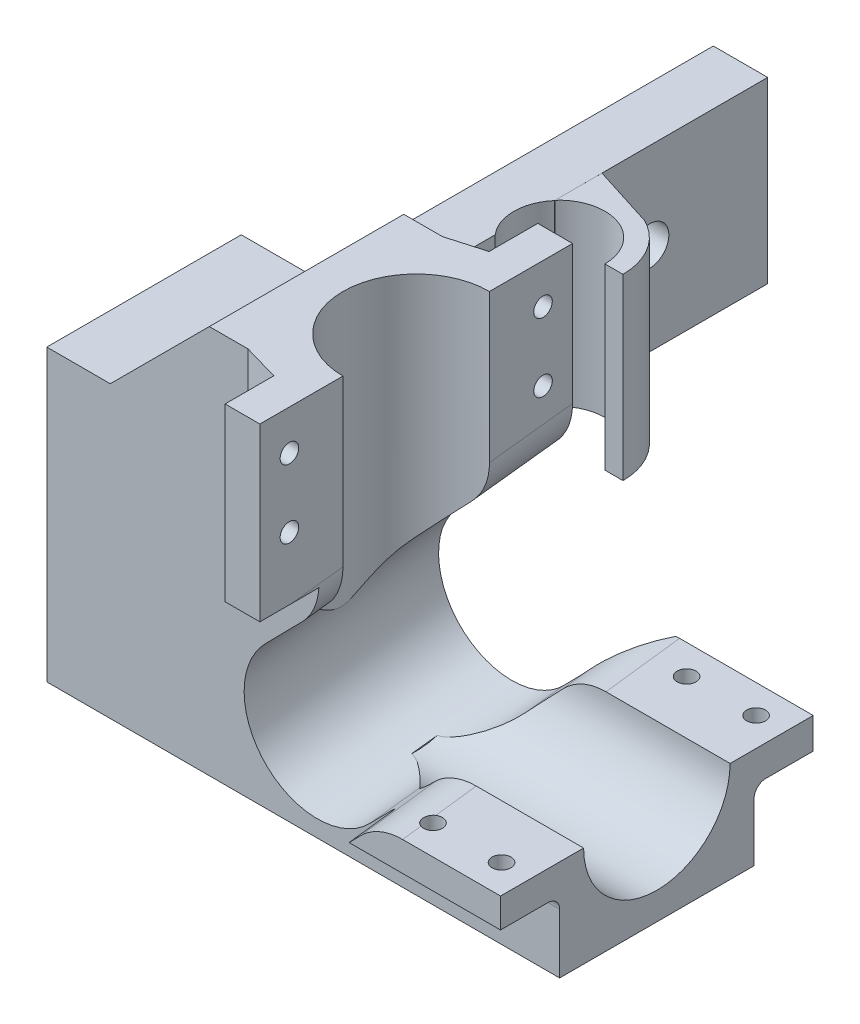
from build123d import *
from OCP.BRepFilletAPI import BRepFilletAPI_MakeChamfer
from build123d.topology import SkipClean

# Parameters (mm, degrees)
BOSS_EXTRUDE1_START      = -152.4
SKETCH2_W                = 105.618637884
SKETCH2_H                = 145.103309092
BOSS_EXTRUDE1_DEPTH      = 139.7
CUT_EXTRUDE2_DEPTH       = 885.237993682
CUT_EXTRUDE2_DEPTH_BACK  = 51.562
SKETCH5_R                = 12.827
CUT_EXTRUDE3_DEPTH       = 445.860765858
CUT_EXTRUDE3_DEPTH_BACK  = 42.164
SKETCH6_R                = 12.827
CUT_EXTRUDE4_DEPTH       = 445.860765858
CUT_EXTRUDE4_DEPTH_BACK  = 445.860765858
CUT_EXTRUDE5_DEPTH       = 50.504651
CUT_EXTRUDE6_DEPTH       = 407.363854058
CUT_EXTRUDE6_DEPTH_BACK  = 407.363854058
SKETCH9_R                = 3.3782
CUT_EXTRUDE7_DEPTH       = 877.507710408
CUT_EXTRUDE7_DEPTH_BACK  = 877.507710408
SKETCH10_W               = 42.138106051
SKETCH10_H               = 18.044478892
SKETCH14_W               = 10.350939284
SKETCH14_H               = 12.032329604
CUT_EXTRUDE9_DEPTH       = 389.423133713
SKETCH15_R               = 7.9375
CUT_EXTRUDE10_DEPTH      = 855.097071361
BOSS_EXTRUDE3_DEPTH      = 31.28
CUT_EXTRUDE11_REACH      = 385.336
SKETCH17_W               = 10.350939284
SKETCH17_H               = 5.407782796
CUT_EXTRUDE12_REACH      = 385.336
SKETCH18_W               = 82.65793149
SKETCH18_H               = 30.038621058
SKETCH20_R               = 1.625
CUT_EXTRUDE13_DEPTH      = 6.088729488
SKETCH21_R               = 1.65
CUT_EXTRUDE14_DEPTH      = 854.709330565
FILLET1_R                = 2.032
FILLET2_R                = 12.7
CUT_EXTRUDE15_DEPTH      = 825.577740132
CUT_EXTRUDE15_DEPTH_BACK = 825.577740132
FILLET3_R                = 10.16
CUT_EXTRUDE16_DEPTH      = 855.611797525
CUT_EXTRUDE16_DEPTH_BACK = 17.338621
SKETCH23_W               = 28.46620038
SKETCH23_H               = 34.049959426
CHAMFER1_SIZE            = 17.3482
CHAMFER2_START           = -213.720216756
CHAMFER2_DEPTH           = 31.28
CHAMFER2_2_DEPTH         = 31.28
CHAMFER3_SIZE            = 5.969
CHAMFER3_SIZE2           = 10.33861127
CHAMFER4_SIZE            = 6.35
CHAMFER4_SIZE2           = 1.8208332


with BuildPart() as part:
    # Sketch2 → Boss-Extrude1 (new body)
    with BuildSketch(Plane(origin=(0, 0, 0), x_dir=(1, 0, 0), z_dir=(0, 1, 0)).offset(BOSS_EXTRUDE1_START)):
        with Locations((-760.171212891, -245.918743343)):
            Rectangle(SKETCH2_W, SKETCH2_H)
    extrude(amount=-BOSS_EXTRUDE1_DEPTH)

    # Sketch5 → Cut-Extrude2 (cut, two sides: drawn at the far end of the back side and taken through both)
    with BuildSketch(Plane(origin=(0, -152.4, 0), x_dir=(1, 0, 0), z_dir=(0, 1, 0)).offset(-CUT_EXTRUDE2_DEPTH_BACK)):
        with Locations(Location((-749.5, -273.05, 0), (0, 0, 90))):
            Circle(SKETCH5_R)
    extrude(amount=CUT_EXTRUDE2_DEPTH + CUT_EXTRUDE2_DEPTH_BACK, mode=Mode.SUBTRACT)

    # Sketch6 → Cut-Extrude3 (cut, two sides: drawn at the far end of the back side and taken through both)
    with SkipClean():  # the faces are left unmerged after this step: merging them gives an invalid solid
        with BuildSketch(Plane(origin=(-707.361893949, 0, 0), x_dir=(0, 0, -1), z_dir=(1, 0, 0)).offset(-CUT_EXTRUDE3_DEPTH_BACK)):
            with Locations((-273.05, -202.904651163)):
                Circle(SKETCH6_R)
        extrude(amount=CUT_EXTRUDE3_DEPTH + CUT_EXTRUDE3_DEPTH_BACK, mode=Mode.SUBTRACT)

    # Sketch7 → Cut-Extrude4 (cut, two sides: drawn at the far end of the back side and taken through both)
    with SkipClean():  # the faces are left unmerged after this step: merging them gives an invalid solid
        with BuildSketch(Plane.ZY.offset(812.980531833).offset(-CUT_EXTRUDE4_DEPTH_BACK)):
            Polygon((173.367088797, -229.244173065), (318.470397889, -229.244173065), (436.616381599, -1092.879705033), (85.103632852, -1063.090489038), align=None)
        extrude(amount=CUT_EXTRUDE4_DEPTH + CUT_EXTRUDE4_DEPTH_BACK, mode=Mode.SUBTRACT)

    # Sketch8 → Cut-Extrude5 (cut)
    with BuildSketch(Plane.XZ.offset(152.4)):
        Polygon((-749.5, 285.877), (-749.5, 318.470397889), (-702.312681678, 322.788236882), (-679.04046523, 133.358726973), (-749.5, 173.367088797), (-749.5, 260.223), align=None)
    extrude(amount=CUT_EXTRUDE5_DEPTH, mode=Mode.SUBTRACT)

    # Sketch9 → Cut-Extrude6 (cut, two sides: drawn at the far end of the back side and taken through both)
    with BuildSketch(Plane.ZY.offset(812.980531833).offset(-CUT_EXTRUDE6_DEPTH_BACK)):
        with Locations((237.744, -197.6755)):
            Circle(SKETCH9_R)
        with Locations((194.056, -197.6755)):
            Circle(SKETCH9_R)
    extrude(amount=CUT_EXTRUDE6_DEPTH + CUT_EXTRUDE6_DEPTH_BACK, mode=Mode.SUBTRACT)

    # Sketch10 → Cut-Extrude7 (cut, two sides: drawn at the far end of the back side and taken through both)
    with BuildSketch(Plane(origin=(0, -152.4, 0), x_dir=(1, 0, 0), z_dir=(0, 1, 0)).offset(-CUT_EXTRUDE7_DEPTH_BACK)):
        Polygon((-797.161154045, -290.074979713), (-797.161154045, -173.367088797), (-812.980531833, -173.367088797), (-812.980531833, -318.470397889), (-778.610494828, -318.470397889), (-749.5, -318.470397889), (-749.5, -300.425918997), (-755.588729488, -300.425918997), (-755.588729488, -290.074979713), align=None)
        with BuildLine():
            Line((-704.994967799, -245.674081003), (-704.994967799, -173.367088797))
            Line((-704.994967799, -173.367088797), (-749.5, -173.367088797))
            Line((-749.5, -173.367088797), (-749.5, -245.674081003))
            Line((-749.5, -245.674081003), (-749.5, -254.969))
            ThreePointArc((-749.5, -254.969), (-746.410185862, -255.23496114), (-743.411270512, -256.025020287))
            Line((-743.411270512, -256.025020287), (-731.419, -256.025020287))
            Line((-731.419, -256.025020287), (-731.419, -245.674081003))
            Line((-731.419, -245.674081003), (-704.994967799, -245.674081003))
        make_face()
        Polygon((-749.5, -245.674081003), (-749.5, -173.367088797), (-787.636154045, -173.367088797), (-787.636154045, -256.025020287), (-755.588729488, -256.025020287), (-755.588729488, -245.674081003), align=None)
        with Locations((-728.430946975, -309.448158443)):
            Rectangle(SKETCH10_W, SKETCH10_H)
    extrude(amount=CUT_EXTRUDE7_DEPTH + CUT_EXTRUDE7_DEPTH_BACK, mode=Mode.SUBTRACT)

    # Sketch14 → Cut-Extrude9 (cut, through all)
    with BuildSketch(Plane.ZY.offset(797.161154045)):
        Polygon((173.367088797, -229.244173065), (173.367088797, -213.720216756), (256.025020287, -213.720216756), (256.025020287, -220.515241206), (290.074979713, -220.515241206), (290.074979713, -208.059525422), (300.425918997, -208.059525422), (300.425918997, -229.244173065), (290.074979713, -229.244173065), (256.025020287, -229.244173065), align=None)
        with Locations((295.250449355, -188.416164802)):
            Rectangle(SKETCH14_W, SKETCH14_H)
    extrude(amount=-CUT_EXTRUDE9_DEPTH, mode=Mode.SUBTRACT)

    # Sketch15 → Cut-Extrude10 (cut, through all)
    with BuildSketch(Plane.XZ.offset(213.720216756)):
        with Locations((-781.622028853, 215.9)):
            Circle(SKETCH15_R)
    extrude(amount=-CUT_EXTRUDE10_DEPTH, mode=Mode.SUBTRACT)

    # Sketch16 → Boss-Extrude3 (add)
    with BuildSketch(Plane.XZ.offset(213.720216756)):
        with BuildLine():
            Line((-789.623028853, 215.9), (-792.798028853, 215.9))
            ThreePointArc((-792.798028853, 215.9), (-781.622028853, 204.724), (-770.446028853, 215.9))
            Line((-770.446028853, 215.9), (-773.621028853, 215.9))
            ThreePointArc((-773.621028853, 215.9), (-781.622028853, 207.899), (-789.623028853, 215.9))
        make_face()
    extrude(amount=-BOSS_EXTRUDE3_DEPTH)

    # Cut-Extrude11: up to this face of the body (flat: up to its plane)
    cut_extrude11_end = Plane(part.part.faces().sort_by_distance((-787.636154045, -182.811410497, 238.56635645))[0])
    # Sketch17 → Cut-Extrude11 (cut, up to the picked face)
    with BuildSketch(Plane(origin=(-707.361893949, 0, 0), x_dir=(0, 0, -1), z_dir=(1, 0, 0)), mode=Mode.PRIVATE) as cut_extrude11_sk1:
        with Locations((-250.849550645, -211.016325358)):
            Rectangle(SKETCH17_W, SKETCH17_H)
    cut_extrude11_tool1 = split(extrude(cut_extrude11_sk1.sketch, amount=-CUT_EXTRUDE11_REACH, mode=Mode.PRIVATE), bisect_by=cut_extrude11_end, keep=Keep.BOTH, mode=Mode.PRIVATE)
    add(cut_extrude11_tool1.solids().sort_by(Axis((-707.361894, -211.016325, 250.849551), (-1, 0, 0)))[0], mode=Mode.SUBTRACT)

    # Cut-Extrude12: up to this face of the body (flat: up to its plane)
    cut_extrude12_end = Plane(part.part.faces().sort_by_distance((-787.636154045, -181.897567062, 191.002801609))[0])
    # Sketch18 → Cut-Extrude12 (cut, up to the picked face)
    with BuildSketch(Plane.ZY.offset(797.161154045), mode=Mode.PRIVATE) as cut_extrude12_sk1:
        with Locations((214.696054542, -167.419310529)):
            Rectangle(SKETCH18_W, SKETCH18_H)
    cut_extrude12_tool1 = split(extrude(cut_extrude12_sk1.sketch, amount=-CUT_EXTRUDE12_REACH, mode=Mode.PRIVATE), bisect_by=cut_extrude12_end, keep=Keep.BOTH, mode=Mode.PRIVATE)
    add(cut_extrude12_tool1.solids().sort_by(Axis((-797.161154, -167.419311, 214.696055), (1, 0, 0)))[0], mode=Mode.SUBTRACT)

    # Sketch20 → Cut-Extrude13 (cut)
    with BuildSketch(Plane.ZY.offset(749.5)):
        with Locations((295.250449355, -159.4)):
            Circle(SKETCH20_R)
        with Locations((295.250449355, -171.4)):
            Circle(SKETCH20_R)
        with Locations((250.849550645, -159.4)):
            Circle(SKETCH20_R)
        with Locations((250.849550645, -171.4)):
            Circle(SKETCH20_R)
    extrude(amount=CUT_EXTRUDE13_DEPTH, mode=Mode.SUBTRACT)

    # Sketch21 → Cut-Extrude14 (cut, through all)
    with BuildSketch(Plane.XZ.offset(208.059525422)):
        with Locations(Location((-724.361893949, 295.250449355, 0), (0, 0, 270))):
            Circle(SKETCH21_R)
        with Locations(Location((-712.361893949, 295.250449355, 0), (0, 0, 270))):
            Circle(SKETCH21_R)
        with Locations(Location((-724.361893949, 250.849550645, 0), (0, 0, 270))):
            Circle(SKETCH21_R)
        with Locations(Location((-712.361893949, 250.674081003, 0), (0, 0, 270))):
            Circle(SKETCH21_R)
    extrude(amount=-CUT_EXTRUDE14_DEPTH, mode=Mode.SUBTRACT)

    # Fillet1
    fillet1_edges = [part.edges().sort_by_distance(p)[0] for p in [
        (-731.475311718, -208.059525422, 290.074979713),
        (-719.390446974, -208.31243396, 256.025020287),
    ]]
    fillet(fillet1_edges, radius=FILLET1_R)

    # Fillet2
    # the kernel refuses this fillet: 12.7 mm, written as the material it adds along each edge
    with BuildSketch(Plane(origin=(-797.161154045, -213.720216756, 256.025020287), x_dir=(0, -1, 0), z_dir=(1, 0, 0))) as fillet2_piece_1:
        with BuildLine():
            CenterArc((12.7, 11.243721081), FILLET2_R, 180, 62.292450476)
            Line((0, 11.243721081), (-0.254, 11.243721081))
            Line((-0.254, 11.243721081), (-0.254, 0))
            Line((-0.254, 0), (0, -0.254))
            ThreePointArc((0, -0.254), (3.397512225, -0.254), (6.676924939, -0.224874422))
            Line((6.676924939, -0.224874422), (6.79502445, 0))
        make_face()
    extrude(amount=9.525)
    with BuildSketch(Plane(origin=(-797.161154045, -182.438621058, 256.025020287), x_dir=(0, 1, 0), z_dir=(1, 0, 0))) as fillet2_piece_2:
        with BuildLine():
            CenterArc((FILLET2_R, -FILLET2_R), FILLET2_R, 90, 90)
            Line((0, -FILLET2_R), (-FILLET2_R * 0.02, -FILLET2_R))
            Line((-FILLET2_R * 0.02, -FILLET2_R), (-FILLET2_R * 0.02, FILLET2_R * 0.02))
            Line((-FILLET2_R * 0.02, FILLET2_R * 0.02), (FILLET2_R, FILLET2_R * 0.02))
            Line((FILLET2_R, FILLET2_R * 0.02), (FILLET2_R, 0))
        make_face()
    extrude(amount=9.525)

    # Sketch22 → Cut-Extrude15 (cut, two sides: drawn at the far end of the back side and taken through both)
    with BuildSketch(Plane(origin=(0, -30.880009338, 265.568080309), x_dir=(1, 0, 0), z_dir=(0, -0.11550085817456393, 0.9933073803012538)).offset(-CUT_EXTRUDE15_DEPTH_BACK)):
        with BuildLine():
            Line((-758.896109044, -160.779431747), (-743.9675024, -145.695751323))
            Line((-743.9675024, -145.695751323), (-725.733898271, -163.741897627))
            Line((-725.733898271, -163.741897627), (-740.662504915, -178.825578052))
            ThreePointArc((-740.662504915, -178.825578052), (-758.802380132, -178.919306964), (-758.896109044, -160.779431747))
        make_face()
    extrude(amount=CUT_EXTRUDE15_DEPTH + CUT_EXTRUDE15_DEPTH_BACK, mode=Mode.SUBTRACT)

    # Fillet3
    # the kernel refuses this fillet: 10.16 mm, written as the material it takes off along each edge
    with BuildSketch(Plane(origin=(-749.5, -183.769844105, 270.597328126), x_dir=(-0.7034437633396176, -0.7059941354664443, -0.08209234133330717), z_dir=(0, 0.11550085817456394, -0.9933073803012537))) as fillet3_piece_1:
        with BuildLine():
            CenterArc((FILLET3_R * 0.411190053836, FILLET3_R), FILLET3_R, 225.296045218, 44.703954782)
            Line((-FILLET3_R * 0.292253709504, FILLET3_R * 0.289249078918), (0, 0))
            Line((0, 0), (FILLET3_R * 0.411190053836, 0))
        make_face()
    extrude(amount=35.535400168, mode=Mode.SUBTRACT)
    with BuildSketch(Plane(origin=(-732.188194017, -202.904651, 270.850357431), x_dir=(0.993529568575603, 0, -0.11357374857763594), z_dir=(-0.11357374857763593, 0, -0.993529568575603))) as fillet3_piece_2:
        with BuildLine():
            CenterArc((FILLET3_R * 0.421124757706, FILLET3_R), FILLET3_R, 224.325671398, 45.674328602)
            Line((-FILLET3_R * 0.294254978904, FILLET3_R * 0.301264118248), (0, 0))
            Line((0, 0), (FILLET3_R * 0.421124757706, 0))
        make_face()
    extrude(amount=25.618457044, mode=Mode.SUBTRACT)
    with BuildSketch(Plane(origin=(-727.59246143, -202.904651, 311.053276428), x_dir=(-0.6942147591455071, -0.7153797366098971, 0.07935805335629142), z_dir=(-0.11357374857763593, 0, -0.993529568575603))) as fillet3_piece_3:
        with BuildLine():
            CenterArc((FILLET3_R * 0.421124757706, -FILLET3_R), FILLET3_R, 90, 45.674328602)
            Line((-FILLET3_R * 0.294254978904, -FILLET3_R * 0.301264118248), (0, 0))
            Line((0, 0), (FILLET3_R * 0.421124757706, 0))
        make_face()
    extrude(amount=36.03680755, mode=Mode.SUBTRACT)
    with BuildSketch(Plane(origin=(-749.5, -187.241004537, 300.449307839), x_dir=(-0.7034437633396176, -0.7059941354664443, -0.08209234133330717), z_dir=(0, 0.11550085817456394, -0.9933073803012537))) as fillet3_piece_4:
        with BuildLine():
            CenterArc((FILLET3_R * 0.411190053836, FILLET3_R), FILLET3_R, 225.296045218, 44.703954782)
            Line((-FILLET3_R * 0.292253709504, FILLET3_R * 0.289249078918), (0, 0))
            Line((0, 0), (FILLET3_R * 0.411190053836, 0))
        make_face()
    extrude(amount=25.114719229, mode=Mode.SUBTRACT)

    # Sketch23 → Cut-Extrude16 (cut, two sides: drawn at the far end of the back side and taken through both)
    with BuildSketch(Plane(origin=(0, -152.4, 0), x_dir=(1, 0, 0), z_dir=(0, 1, 0)).offset(-CUT_EXTRUDE16_DEPTH_BACK)):
        with Locations((-782.928053855, -273.05)):
            Rectangle(SKETCH23_W, SKETCH23_H)
    extrude(amount=CUT_EXTRUDE16_DEPTH + CUT_EXTRUDE16_DEPTH_BACK, mode=Mode.SUBTRACT)

    # Chamfer1
    # the kernel refuses this chamfer: 17.3482 mm, written as the material it adds along each edge
    with BuildSketch(Plane(origin=(-768.694953665, -169.738621, 290.074979713), x_dir=(-1, 0, 0), z_dir=(0, 0, -1))) as chamfer1_piece_1_section:
        Polygon((CHAMFER1_SIZE, 0), (0, CHAMFER1_SIZE), (0, 0), align=None)
    chamfer1_piece_1 = extrude(amount=34.049959426, mode=Mode.PRIVATE)
    chamfer1_piece_1 = split(chamfer1_piece_1, bisect_by=Plane(origin=(-768.694953665, -152.4, 290.074979713), z_dir=(0, -1, 0)), keep=Keep.TOP, mode=Mode.PRIVATE)
    add(chamfer1_piece_1)

    # Chamfer2: read off the stored shape, not the designer's step
    # Chamfer2 outline → Chamfer2 (cut)
    with BuildSketch(Plane(origin=(0, 0, 0), x_dir=(1, 0, 0), z_dir=(0, 1, 0)).offset(CHAMFER2_START)):
        with BuildLine():
            ThreePointArc((-776.780335722, -205.827215697), (-778.25040932, -205.244712218), (-779.787979207, -204.875516434))
            Line((-779.787979207, -204.875516434), (-776.780335722, -205.827215697))
        make_face()
    extrude(amount=CHAMFER2_DEPTH, mode=Mode.SUBTRACT)

    # Chamfer2 2 outline → Chamfer2 2 (add)
    with BuildSketch(Plane(origin=(0, 0, 0), x_dir=(1, 0, 0), z_dir=(0, 1, 0)).offset(CHAMFER2_START)):
        with BuildLine():
            Line((-779.787979207, -204.875516434), (-787.636154045, -202.392142911))
            Line((-787.636154045, -202.392142911), (-787.636154045, -206.480165916))
            ThreePointArc((-787.636154045, -206.480165916), (-783.860774681, -204.950525441), (-779.787979207, -204.875516434))
        make_face()
    extrude(amount=CHAMFER2_2_DEPTH)

    # Chamfer3
    chamfer3_edges = [part.edges().sort_by_distance(p)[0] for p in [
        (-731.419, -206.707684668, 256.025020287),
    ]]
    chamfer3_side = [part.faces().sort_by_distance(p)[0] for p in [
        (-762.95297508, -193.800929084, 256.025020287),
    ]]
    chamfer(chamfer3_edges, length=CHAMFER3_SIZE, length2=CHAMFER3_SIZE2, reference=chamfer3_side[0])

    # Chamfer4: one chamfer whose edges measure the first distance from different faces: ONE call of the kernel's chamfer builder (chamfer() names one face for all edges)
    chamfer4_edges_1 = [part.edges().sort_by_distance(p)[0] for p in [
        (-755.588729488, -170.33440865, 256.025020287),
    ]]
    chamfer4_side_1 = [part.faces().sort_by_distance(p)[0] for p in [
        (-763.393423187, -193.595325956, 256.025020287),
    ]]
    chamfer4_edges_2 = [part.edges().sort_by_distance(p)[0] for p in [
        (-755.588729488, -167.4, 290.074979713),
    ]]
    chamfer4_side_2 = [part.faces().sort_by_distance(p)[0] for p in [
        (-768.5704824, -193.114216517, 290.074979713),
    ]]
    chamfer4 = BRepFilletAPI_MakeChamfer(part.part.solid().wrapped)
    for e in chamfer4_edges_1:
        chamfer4.Add(CHAMFER4_SIZE, CHAMFER4_SIZE2, e.wrapped, chamfer4_side_1[0].wrapped)  # the first distance lies on this face
    for e in chamfer4_edges_2:
        chamfer4.Add(CHAMFER4_SIZE, CHAMFER4_SIZE2, e.wrapped, chamfer4_side_2[0].wrapped)  # the first distance lies on this face
    add(Compound.cast(chamfer4.Shape()), mode=Mode.REPLACE)


solid = part.part
